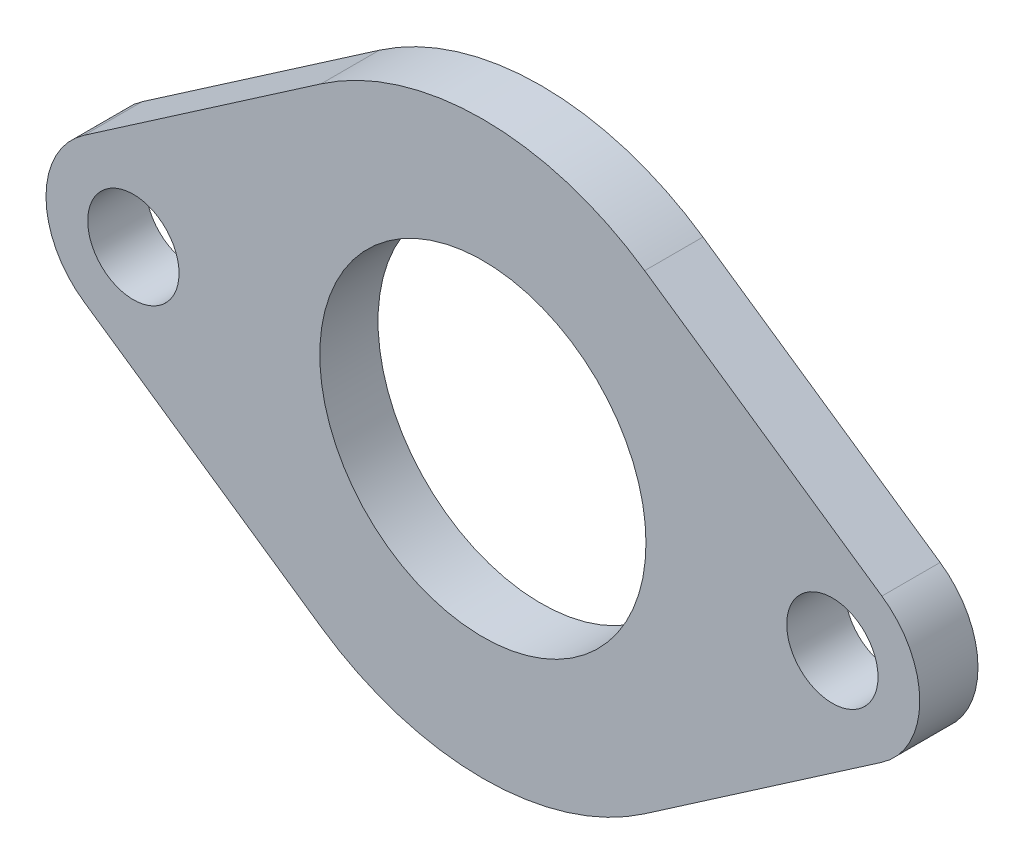
from build123d import *

# Parameters (mm, degrees)
SKETCH1_R           = 2.4892
SKETCH1_R_2         = 8.89
BOSS_EXTRUDE1_DEPTH = 3.175


with BuildPart() as part:
    # Sketch1 → Boss-Extrude1 (new body)
    with BuildSketch(Plane.XY):
        with BuildLine():
            Line((-21.749385, 3.923611458), (-8.819430672, 12.819223355))
            ThreePointArc((-8.819430672, 12.819223355), (0, 15.56004), (8.819430672, 12.819223355))
            Line((8.819430672, 12.819223355), (21.749385, 3.923611458))
            ThreePointArc((21.749385, 3.923611458), (23.8125, 0), (21.749385, -3.923611458))
            Line((21.749385, -3.923611458), (8.819430672, -12.819223355))
            ThreePointArc((8.819430672, -12.819223355), (0, -15.56004), (-8.819430672, -12.819223355))
            Line((-8.819430672, -12.819223355), (-21.749385, -3.923611458))
            ThreePointArc((-21.749385, -3.923611458), (-23.8125, 0), (-21.749385, 3.923611458))
        make_face()
        with Locations((-19.05, 0)):
            Circle(SKETCH1_R, mode=Mode.SUBTRACT)
        with Locations((19.05, 0)):
            Circle(SKETCH1_R, mode=Mode.SUBTRACT)
        Circle(SKETCH1_R_2, mode=Mode.SUBTRACT)
    extrude(amount=BOSS_EXTRUDE1_DEPTH)


solid = part.part
